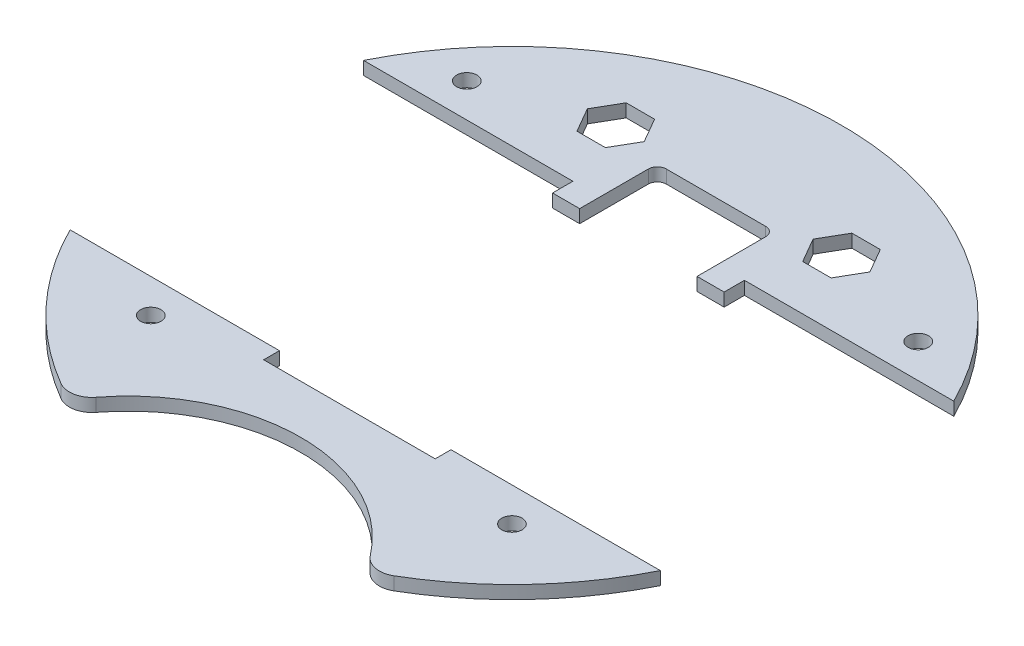
from build123d import *

# Parameters (mm, degrees)
BOSS_EXTRUDE1_DEPTH  = 2.9
SOLENOID_PLACEMENT_W = 38
SOLENOID_PLACEMENT_H = 64
CUT_EXTRUDE1_DEPTH   = 104.278313309
CUT_EXTRUDE5_DEPTH   = 104.278313309
SKETCH6_R            = 2.25
CUT_EXTRUDE6_DEPTH   = 104.278313309
CUT_EXTRUDE3_DEPTH   = 104.278313309
CUT_EXTRUDE7_DEPTH   = 99.031423533


with BuildPart() as part:
    # Sketch1 → Boss-Extrude1 (new body)
    with BuildSketch(Plane(origin=(0, 0, 0), x_dir=(1, 0, 0), z_dir=(0, 1, 0))):
        with BuildLine():
            ThreePointArc((36.856602833, -63.012624351), (0, 73), (-36.856602833, -63.012624351))
            ThreePointArc((-36.856602833, -63.012624351), (-33.368752207, -63.602994345), (-30.363140064, -61.737536127))
            ThreePointArc((-30.363140064, -61.737536127), (0, -46.75), (30.363140064, -61.737536127))
            ThreePointArc((30.363140064, -61.737536127), (33.368752207, -63.602994345), (36.856602833, -63.012624351))
        make_face()
    extrude(amount=BOSS_EXTRUDE1_DEPTH)

    # solenoid placement → Cut-Extrude1 (cut, through all)
    with BuildSketch(Plane(origin=(0, 2.9, 0), x_dir=(1, 0, 0), z_dir=(0, 1, 0))):
        with Locations((0, -4)):
            Rectangle(SOLENOID_PLACEMENT_W, SOLENOID_PLACEMENT_H)
    extrude(amount=-CUT_EXTRUDE1_DEPTH, mode=Mode.SUBTRACT)

    # Sketch5 → Cut-Extrude5 (cut, through all)
    with BuildSketch(Plane(origin=(0, 2.9, 0), x_dir=(1, 0, 0), z_dir=(0, 1, 0))):
        Polygon((-18.706882066, 48), (-21.853441033, 53.45), (-28.146558967, 53.45), (-31.293117934, 48), (-28.146558967, 42.55), (-21.853441033, 42.55), align=None)
        Polygon((18.706882066, 48), (21.853441033, 42.55), (28.146558967, 42.55), (31.293117934, 48), (28.146558967, 53.45), (21.853441033, 53.45), align=None)
    extrude(amount=-CUT_EXTRUDE5_DEPTH, mode=Mode.SUBTRACT)

    # Sketch6 → Cut-Extrude6 (cut, through all)
    with BuildSketch(Plane(origin=(0, 2.9, 0), x_dir=(1, 0, 0), z_dir=(0, 1, 0))):
        with Locations((-50, 40)):
            Circle(SKETCH6_R)
        with Locations((50, 40)):
            Circle(SKETCH6_R)
        with Locations((40, -40)):
            Circle(SKETCH6_R)
        with Locations((-40, -40)):
            Circle(SKETCH6_R)
    extrude(amount=-CUT_EXTRUDE6_DEPTH, mode=Mode.SUBTRACT)

    # Sketch3 → Cut-Extrude3 (cut, through all)
    with BuildSketch(Plane(origin=(0, 2.9, 0), x_dir=(1, 0, 0), z_dir=(0, 1, 0))):
        Polygon((-19, 28), (-19, 32.5), (-73, 32.5), (-73, -32.5), (73, -32.5), (73, 32.5), (19, 32.5), (19, 28), align=None)
    extrude(amount=-CUT_EXTRUDE3_DEPTH, mode=Mode.SUBTRACT)


with BuildPart() as cut_extrude3_piece_1:
    # of the separate pieces the step leaves, piece 1, a body of its own (cut_extrude3_pieces)
    add(part.part.solids().sort_by_distance((65.366275709, 0, -32.5))[0])

    # Sketch7 → Cut-Extrude7 (cut, through all)
    with BuildSketch(Plane(origin=(0, 2.9, 0), x_dir=(1, 0, 0), z_dir=(0, 1, 0))):
        with BuildLine():
            Line((-13, 28), (13, 28))
            Line((13, 28), (13, 43.2))
            ThreePointArc((13, 43.2), (12.414213562, 44.614213562), (11, 45.2))
            Line((11, 45.2), (-11, 45.2))
            ThreePointArc((-11, 45.2), (-12.414213562, 44.614213562), (-13, 43.2))
            Line((-13, 43.2), (-13, 28))
        make_face()
    extrude(amount=-CUT_EXTRUDE7_DEPTH, mode=Mode.SUBTRACT)


with BuildPart() as cut_extrude3_piece_2:
    # of the separate pieces the step leaves, piece 2, a body of its own (cut_extrude3_pieces)
    add(part.part.solids().sort_by_distance((-36.856602833, 0, 63.012624351))[0])


solid = Compound([cut_extrude3_piece_1.part, cut_extrude3_piece_2.part])
